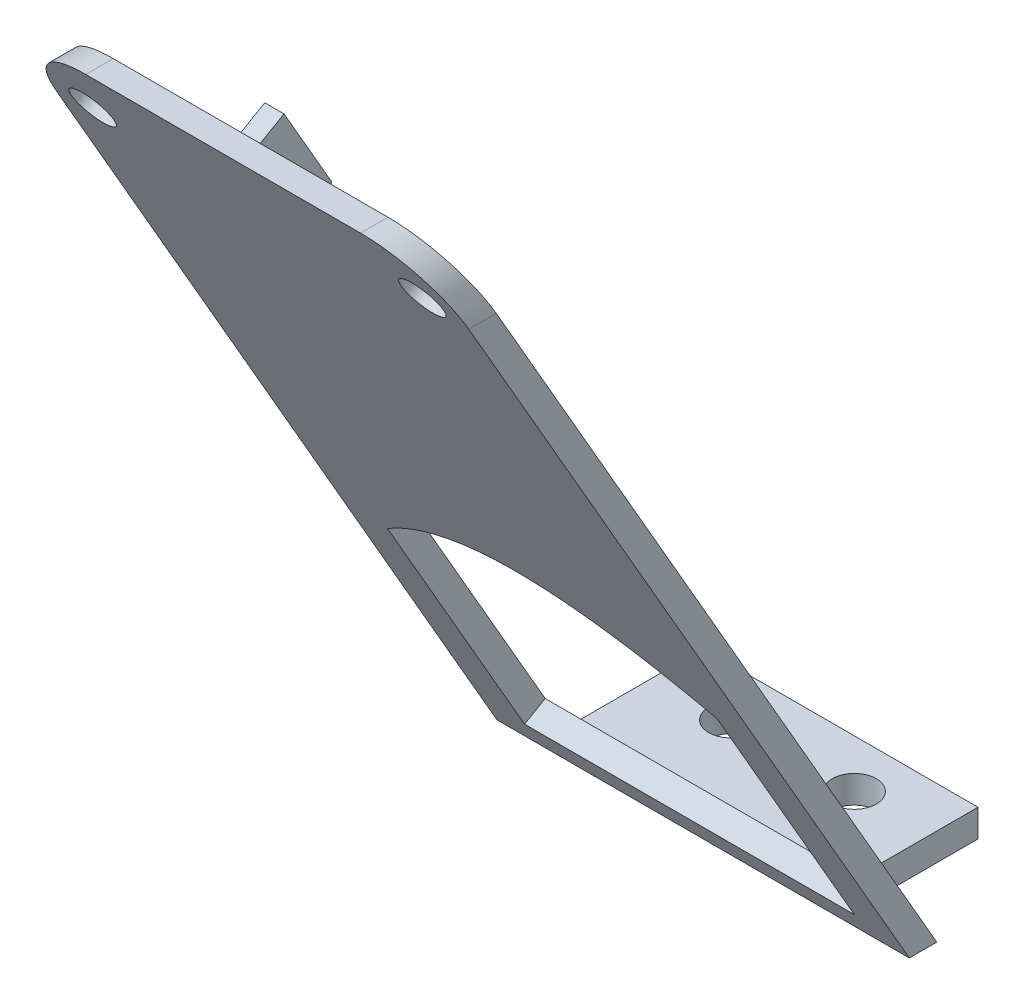
from build123d import *

# Parameters (mm, degrees)
SKETCH_1_W           = 20
SKETCH_1_H           = 10
SKETCH_1_R           = 1.6
EXTRUDE_1_DEPTH      = 2
EXTRUDE_2_DEPTH      = 5
EXTRUDE_2_DEPTH_BACK = 25
FILLET_1_R           = 5
SKETCH_3_R           = 1.55
CUT_EXTRUDE_1_DEPTH  = 10
SKETCH_4_W           = 1.4
SKETCH_4_H           = 7
EXTRUDE_3_DEPTH      = 2


with BuildPart() as part:
    # 草图1 → 凸台-拉伸1 (new body)
    with BuildSketch(Plane(origin=(0, 0, 0), x_dir=(1, 0, 0), z_dir=(0, 1, 0))):
        Rectangle(SKETCH_1_W, SKETCH_1_H)
        with Locations(Location((-4.5, 1.5, 0), (0, 0, 270))):
            Circle(SKETCH_1_R, mode=Mode.SUBTRACT)
        with Locations(Location((4.5, 1.5, 0), (0, 0, 90))):
            Circle(SKETCH_1_R, mode=Mode.SUBTRACT)
    extrude(amount=EXTRUDE_1_DEPTH)

    # 草图2 → 凸台-拉伸2 (add, two sides: drawn at the far end of the back side and taken through both)
    with BuildSketch(Plane(origin=(10, 0, 0), x_dir=(0, 0, -1), z_dir=(1, 0, 0)).offset(-EXTRUDE_2_DEPTH_BACK)):
        Polygon((-5, 0), (-3, 0), (-37.93939209, 60.656729885), (-39.93939209, 60.656729885), align=None)
    extrude(amount=EXTRUDE_2_DEPTH + EXTRUDE_2_DEPTH_BACK)

    # 圆角1
    # the kernel refuses this fillet: 5 mm, written as the material it takes off along each edge
    with BuildSketch(Plane(origin=(-15, 60.656729885, 25.43939209), x_dir=(1, 0, 0), z_dir=(0, 0, 1)), Plane(origin=(15, 60.656729885, 25.43939209), x_dir=(0, -1, 0), z_dir=(0, 0, 1))) as fillet_1_piece_1:
        with BuildLine():
            CenterArc((FILLET_1_R, -FILLET_1_R), FILLET_1_R, 90, 90)
            Line((0, -FILLET_1_R), (0, 0))
            Line((0, 0), (FILLET_1_R, 0))
        make_face()
    extrude(amount=27, mode=Mode.SUBTRACT)

    # 草图3 → 切除-拉伸1 (cut)
    with BuildSketch(Plane(origin=(0, -1.297536287, 2.252595233), x_dir=(-1, 0, 0), z_dir=(0, 0.4991341727193529, -0.8665247126445773))):
        with Locations(Location((-12, 67.497402518, 0), (0, 0, 90))):
            Circle(SKETCH_3_R)
        with Locations(Location((12, 67.497402518, 0), (0, 0, 90))):
            Circle(SKETCH_3_R)
        with BuildLine():
            Line((12, 24.497402518), (12, 4.497402518))
            Line((12, 4.497402518), (-12, 4.497402518))
            Line((-12, 4.497402518), (-12, 24.497402518))
            add(Edge.make_bspline(
                [(-12, 24.497402518), (0, 35.211223002), (12, 24.497402518)],
                knots=[0, 0, 0, 1, 1, 1], degree=2))
        make_face()
    extrude(amount=-CUT_EXTRUDE_1_DEPTH, mode=Mode.SUBTRACT)

    # 草图4 → 凸台-拉伸3 (add)
    with BuildSketch(Plane(origin=(0, -1.297536287, 2.252595233), x_dir=(-1, 0, 0), z_dir=(0, 0.4991341727193529, -0.8665247126445773))):
        with Locations((0, 67.997402518)):
            Rectangle(SKETCH_4_W, SKETCH_4_H)
    extrude(amount=EXTRUDE_3_DEPTH)


solid = part.part
